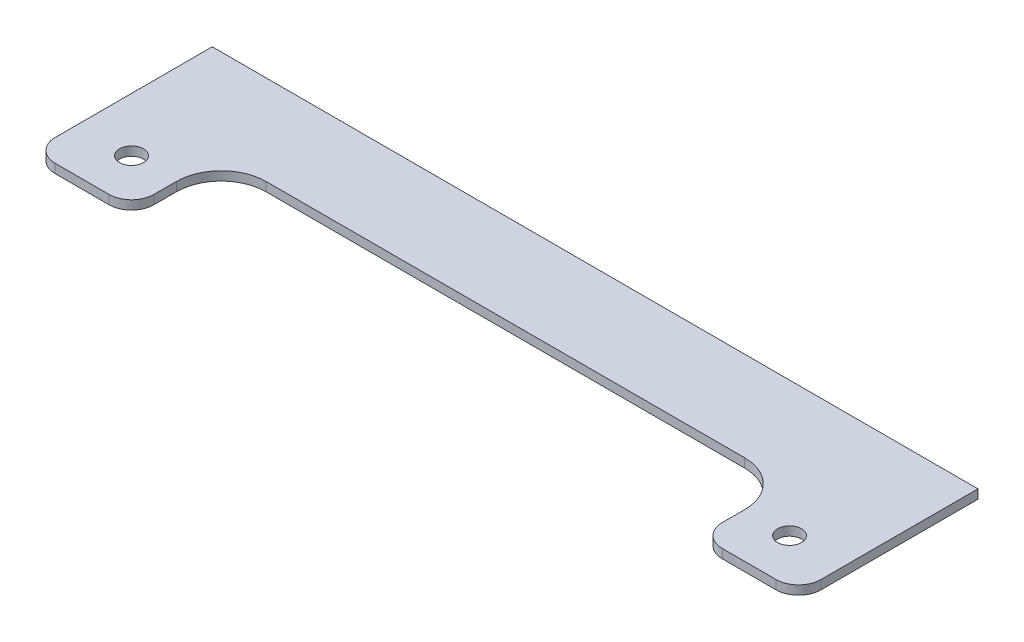
from build123d import *

# Parameters (mm, degrees)
EXTRUDE_1_DEPTH          = 6
CUT_EXTRUDE_1_DEPTH      = 14
CUT_EXTRUDE_1_DEPTH_BACK = 5
SKETCH_7_R               = 8
CUT_EXTRUDE_2_DEPTH      = 11
CUT_EXTRUDE_2_DEPTH_BACK = 5
SKETCH_8_R               = 8


with BuildPart() as part:
    # Эскиз1 → Бобышка-Вытянуть1 (new body)
    with BuildSketch(Plane(origin=(0, 0, 0), x_dir=(1, 0, 0), z_dir=(0, 1, 0))):
        with BuildLine():
            Line((-330.202898551, 15), (-330.202898551, 120))
            Line((-330.202898551, 120), (181.797101449, 120))
            Line((181.797101449, 120), (181.797101449, 15))
            ThreePointArc((181.797101449, 15), (177.403703167, 4.393398282), (166.797101449, 0))
            Line((166.797101449, 0), (130.797101449, 0))
            ThreePointArc((130.797101449, 0), (120.190499731, 4.393398282), (115.797101449, 15))
            Line((115.797101449, 15), (115.797101449, 30))
            ThreePointArc((115.797101449, 30), (107.010304885, 51.213203436), (85.797101449, 60))
            Line((85.797101449, 60), (-234.202898551, 60))
            ThreePointArc((-234.202898551, 60), (-255.416101986, 51.213203436), (-264.202898551, 30))
            Line((-264.202898551, 30), (-264.202898551, 15))
            ThreePointArc((-264.202898551, 15), (-268.596296833, 4.393398282), (-279.202898551, 0))
            Line((-279.202898551, 0), (-315.202898551, 0))
            ThreePointArc((-315.202898551, 0), (-325.809500269, 4.393398282), (-330.202898551, 15))
        make_face()
    extrude(amount=EXTRUDE_1_DEPTH)

    # Эскиз7 → Вырез-Вытянуть1 (cut, two sides: drawn at the far end of the back side and taken through both)
    with BuildSketch(Plane(origin=(0, 0, 0), x_dir=(1, 0, 0), z_dir=(0, 1, 0)).offset(-CUT_EXTRUDE_1_DEPTH_BACK)):
        with Locations((-294.132835349, 29.929618656)):
            Circle(SKETCH_7_R)
    extrude(amount=CUT_EXTRUDE_1_DEPTH + CUT_EXTRUDE_1_DEPTH_BACK, mode=Mode.SUBTRACT)

    # Эскиз8 → Вырез-Вытянуть2 (cut, two sides: drawn at the far end of the back side and taken through both)
    with BuildSketch(Plane(origin=(0, 0, 0), x_dir=(1, 0, 0), z_dir=(0, 1, 0)).offset(-CUT_EXTRUDE_2_DEPTH_BACK)):
        with Locations((145.867482793, 29.929617215)):
            Circle(SKETCH_8_R)
    extrude(amount=CUT_EXTRUDE_2_DEPTH + CUT_EXTRUDE_2_DEPTH_BACK, mode=Mode.SUBTRACT)


solid = part.part
